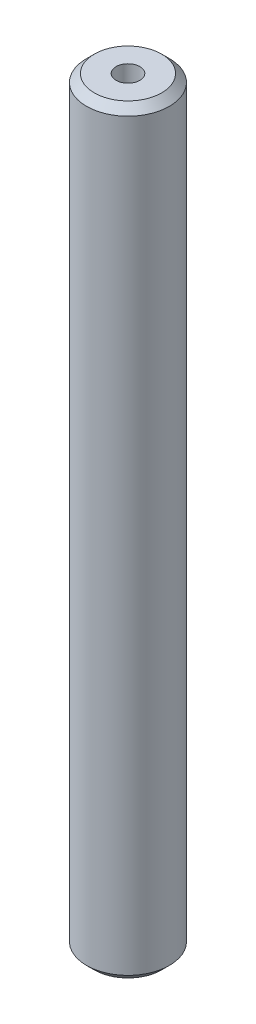
from build123d import *

# Parameters (mm, degrees)
SKETCH1_R           = 30
BOSS_EXTRUDE1_DEPTH = 550.320533962
SKETCH2_R           = 8.638337875
CUT_EXTRUDE1_DEPTH  = 552.953521685
CHAMFER1_SIZE       = 5.616152516


with BuildPart() as part:
    # Sketch1 → Boss-Extrude1 (new body)
    with BuildSketch(Plane(origin=(0, 0, 0), x_dir=(1, 0, 0), z_dir=(0, 1, 0))):
        Circle(SKETCH1_R)
    extrude(amount=BOSS_EXTRUDE1_DEPTH)

    # Sketch2 → Cut-Extrude1 (cut, through all)
    with BuildSketch(Plane(origin=(0, 0, 0), x_dir=(1, 0, 0), z_dir=(0, 1, 0))):
        Circle(SKETCH2_R)
    extrude(amount=CUT_EXTRUDE1_DEPTH, mode=Mode.SUBTRACT)

    # Chamfer1
    chamfer1_edges = [part.edges().sort_by_distance(p)[0] for p in [
        (-30, 550.320533962, 0),
        (-30, 0, 0),
    ]]
    chamfer(chamfer1_edges, length=CHAMFER1_SIZE)


solid = part.part
